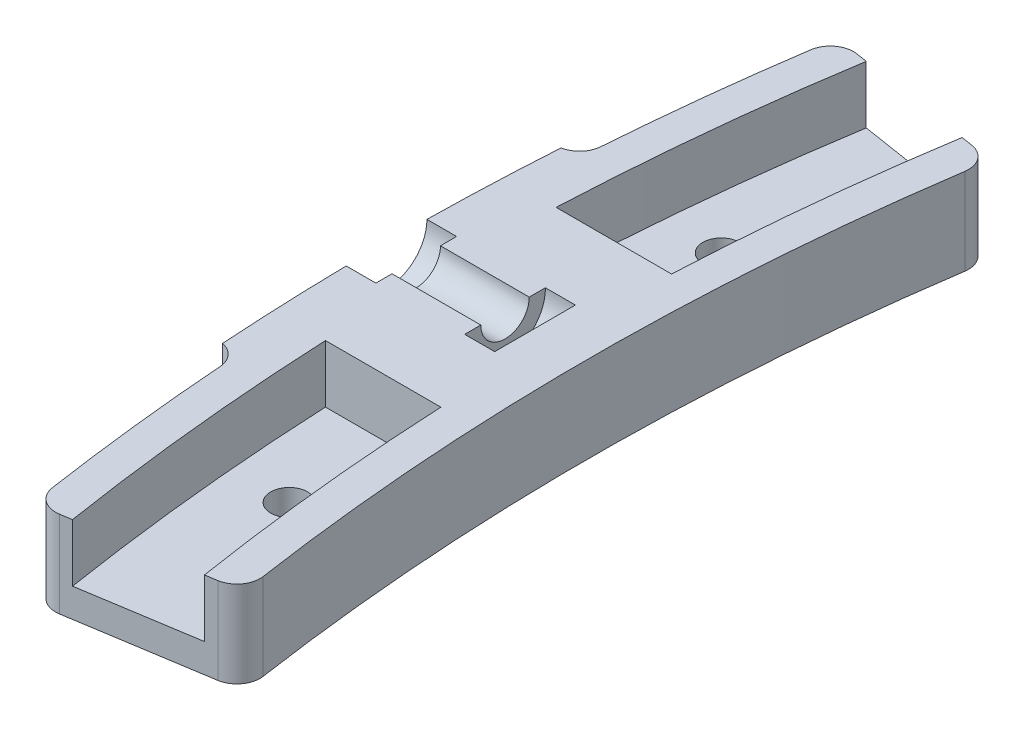
from build123d import *

# Parameters (mm, degrees)
BOSS_EXTRUDE1_DEPTH            = 7.5
BOSS_EXTRUDE2_DEPTH            = 7.5
CUT_EXTRUDE1_DEPTH             = 5
F_3_2_3_2_DIAMETER_HOLE1_D     = 3.2
FILLET1_R                      = 2
FILLET2_R                      = 2
CUT_EXTRUDE2_REACH             = 39.378
CUT_EXTRUDE2_END_RADIUS        = 224.5
SKETCH22_R                     = 2.1
CUT_EXTRUDE2_DIRECTION_2_DEPTH = 0.9
SKETCH23_R                     = 3.5
CUT_EXTRUDE3_DEPTH             = 2.6
SKETCH24_W                     = 2.6
SKETCH24_H                     = 3.5


with BuildPart() as part:
    # Sketch1 → Boss-Extrude1 (new body)
    with BuildSketch(Plane(origin=(0, 0, 0), x_dir=(1, 0, 0), z_dir=(0, 1, 0))):
        with BuildLine():
            ThreePointArc((-207.414551525, 32.851237658), (-210, 0), (-207.414551525, -32.851237658))
            Line((-207.414551525, -32.851237658), (-217.291434931, -34.415582309))
            ThreePointArc((-217.291434931, -34.415582309), (-220, 0), (-217.291434931, 34.415582309))
            Line((-217.291434931, 34.415582309), (-207.414551525, 32.851237658))
        make_face()
        with BuildLine():
            ThreePointArc((-217.291434931, -34.415582309), (-220, 0), (-217.291434931, 34.415582309))
            Line((-217.291434931, 34.415582309), (-220.254499953, 34.884885704))
            ThreePointArc((-220.254499953, 34.884885704), (-223, 0), (-220.254499953, -34.884885704))
            Line((-220.254499953, -34.884885704), (-217.291434931, -34.415582309))
        make_face()
        with BuildLine():
            Line((-204.451486503, 32.381934263), (-207.414551525, 32.851237658))
            ThreePointArc((-207.414551525, 32.851237658), (-210, 0), (-207.414551525, -32.851237658))
            Line((-207.414551525, -32.851237658), (-204.451486503, -32.381934263))
            ThreePointArc((-204.451486503, -32.381934263), (-207, 0), (-204.451486503, 32.381934263))
        make_face()
    extrude(amount=BOSS_EXTRUDE1_DEPTH)

    # Sketch19 → Boss-Extrude2 (add)
    with BuildSketch(Plane(origin=(0, 0, 0), x_dir=(1, 0, 0), z_dir=(0, 1, 0))):
        with BuildLine():
            Line((-224.019328267, 14.683002512), (-222.522539882, 14.584897818))
            ThreePointArc((-222.522539882, 14.584897818), (-223, 0), (-222.522539882, -14.584897818))
            Line((-222.522539882, -14.584897818), (-224.019328267, -14.683002512))
            ThreePointArc((-224.019328267, -14.683002512), (-224.5, 0), (-224.019328267, 14.683002512))
        make_face()
    extrude(amount=BOSS_EXTRUDE2_DEPTH)

    # Sketch15 → Cut-Extrude1 (cut)
    with BuildSketch(Plane(origin=(0, 7.5, 0), x_dir=(1, 0, 0), z_dir=(0, 1, 0))):
        with BuildLine():
            Line((-219.772609758, 10), (-209.761769634, 10))
            ThreePointArc((-209.761769634, 10), (-208.900850883, 21.457737542), (-207.414551525, 32.851237658))
            Line((-207.414551525, 32.851237658), (-217.291434931, 34.415582309))
            ThreePointArc((-217.291434931, 34.415582309), (-218.872736893, 22.242415451), (-219.772609758, 10))
        make_face()
        with BuildLine():
            ThreePointArc((-207.414551525, -32.851237658), (-208.900850883, -21.457737542), (-209.761769634, -10))
            Line((-209.761769634, -10), (-219.772609758, -10))
            ThreePointArc((-219.772609758, -10), (-218.872736893, -22.242415451), (-217.291434931, -34.415582309))
            Line((-217.291434931, -34.415582309), (-207.414551525, -32.851237658))
        make_face()
    extrude(amount=-CUT_EXTRUDE1_DEPTH, mode=Mode.SUBTRACT)

    # Ø3.2 (3.2) Diameter Hole1 (through all)
    with Locations(Plane(origin=(0, 0, 0), x_dir=(-1, 0, 0), z_dir=(0, -1, 0))):
        with Locations((214.18186009, -18.738484691), (214.18186009, 18.738484691)):
            Hole(F_3_2_3_2_DIAMETER_HOLE1_D / 2)

    # Fillet1
    fillet1_edges = [part.edges().sort_by_distance(p)[0] for p in [
        (-220.254499953, 3.75, 34.884885704),
        (-220.254499953, 3.75, -34.884885704),
        (-204.451486503, 3.75, -32.381934263),
        (-204.451486503, 3.75, 32.381934263),
    ]]
    fillet(fillet1_edges, radius=FILLET1_R)

    # Fillet2
    # the kernel refuses this fillet: 2 mm, written as the material it adds along each edge
    with BuildSketch(Plane(origin=(-222.522539882, 0, -14.584897818), x_dir=(0.06970140258603677, 0, -0.9975678996827931), z_dir=(0, 1, 0))) as fillet2_piece_1:
        with BuildLine():
            CenterArc((1.930030715, 1.99998144), FILLET2_R, 194.477374901, 75.275788142)
            Line((-0.006462156, 1.49998608), (-0.045192014, 1.489986173))
            ThreePointArc((-0.045192014, 1.489986173), (-0.043230707, 0.749820716), (-0.039999629, -0.000172324))
            Line((-0.039999629, -0.000172324), (0.000172324, -0.039999629))
            ThreePointArc((0.000172324, -0.039999629), (0.960707253, -0.037930577), (1.921242182, -0.039999629))
            Line((1.921242182, -0.039999629), (1.921414506, 0))
        make_face()
    extrude(amount=7.5)
    with BuildSketch(Plane(origin=(-222.522539882, 0, 14.584897818), x_dir=(-0.9978589232386029, 0, 0.06540312923015226), z_dir=(0, 1, 0))) as fillet2_piece_2:
        with BuildLine():
            CenterArc((1.991648107, 1.938628933), FILLET2_R, 180.493673912, 75.275788142)
            Line((-0.008277654, 1.921396676), (-0.048276169, 1.92105203))
            ThreePointArc((-0.048276169, 1.92105203), (-0.042069052, 0.960534929), (-0.04, 0))
            Line((-0.04, 0), (0, -0.04))
            ThreePointArc((0, -0.04), (0.75, -0.04), (1.490167038, -0.038772579))
            Line((1.490167038, -0.038772579), (1.5, 0))
        make_face()
    extrude(amount=7.5)

    # Cut-Extrude2: up to this cylinder (the profile starts inside it)
    cut_extrude2_end = Plane(origin=(0, 7.5, 0), z_dir=(0, -1, 0)) * Cylinder(CUT_EXTRUDE2_END_RADIUS, 528.756, mode=Mode.PRIVATE)
    # Sketch22 → Cut-Extrude2 (cut, up to the surface)
    with BuildSketch(Plane(origin=(-212.5, 0, 0), x_dir=(0, 0, -1), z_dir=(1, 0, 0)), mode=Mode.PRIVATE) as cut_extrude2_sk1:
        with Locations((0, 7.5)):
            Circle(SKETCH22_R)
    cut_extrude2_tool1 = extrude(cut_extrude2_sk1.sketch, amount=-CUT_EXTRUDE2_REACH, mode=Mode.PRIVATE) & cut_extrude2_end
    add(cut_extrude2_tool1.solids().sort_by_distance((-212.5, 7.5, 0))[0], mode=Mode.SUBTRACT)

    # Sketch22 → Cut-Extrude2 direction 2 (cut)
    with BuildSketch(Plane(origin=(-212.5, 0, 0), x_dir=(0, 0, -1), z_dir=(1, 0, 0))):
        with Locations((0, 7.5)):
            Circle(SKETCH22_R)
    extrude(amount=CUT_EXTRUDE2_DIRECTION_2_DEPTH, mode=Mode.SUBTRACT)

    # Sketch23 → Cut-Extrude3 (cut)
    with BuildSketch(Plane.ZY.offset(211.6)):
        with Locations((0, 7.439199918)):
            Circle(SKETCH23_R)
    extrude(amount=CUT_EXTRUDE3_DEPTH, mode=Mode.SUBTRACT)

    # Sketch24 → Cut-Revolve1 (revolve, cut)
    with BuildSketch(Plane(origin=(0, 7.5, 0), x_dir=(1, 0, 0), z_dir=(0, 1, 0))):
        with Locations((-223.2, 1.75)):
            Rectangle(SKETCH24_W, SKETCH24_H)
    revolve(axis=Axis((-224.5, 7.5, 0), (1, 0, 0)), mode=Mode.SUBTRACT)


solid = part.part
